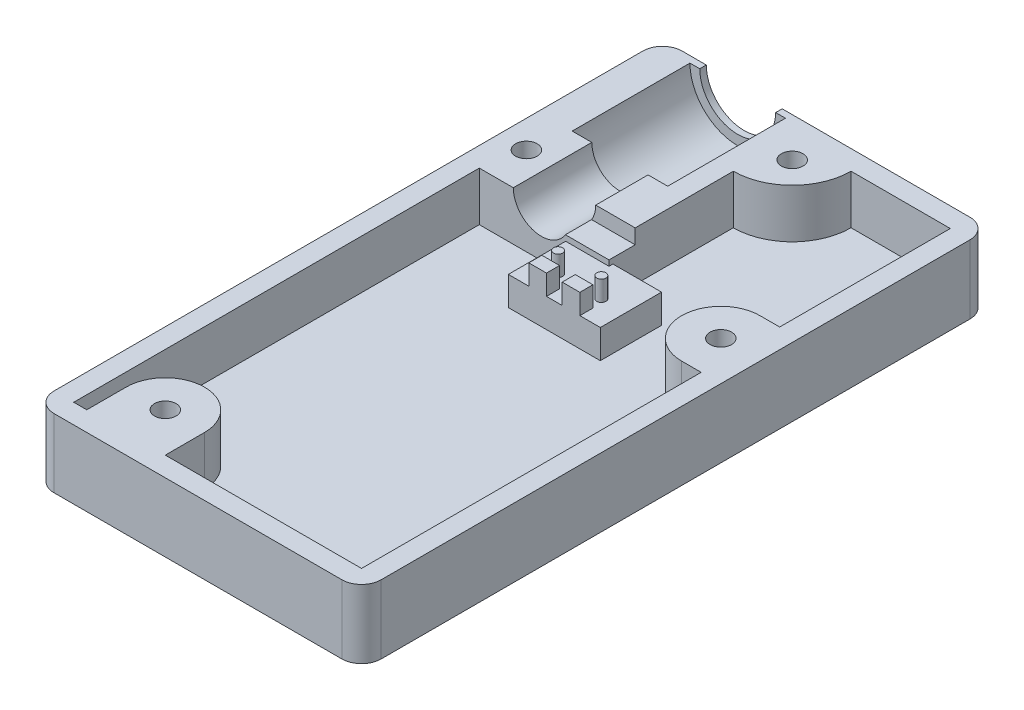
from build123d import *
from build123d.topology import SkipClean

# Parameters (mm, degrees)
SKETCH_1_W               = 50
SKETCH_1_H               = 38
EXTRUDE_1_DEPTH          = 3
SKETCH_2_W               = 50
SKETCH_2_H               = 38
SKETCH_2_W_2             = 44
SKETCH_2_H_2             = 32
EXTRUDE_2_DEPTH          = 90
SKETCH_4_R               = 7.3
CUT_EXTRUDE_1_DEPTH      = 45.2
SKETCH_5_R               = 10.3
SKETCH_5_R_2             = 7.3
EXTRUDE_3_DEPTH          = 16
SKETCH_6_R               = 8.3
SKETCH_6_R_2             = 5.8
EXTRUDE_5_DEPTH          = 1
SKETCH_7_R               = 4.3
EXTRUDE_6_DEPTH          = 2
SKETCH_8_R               = 6.3
SKETCH_8_R_2             = 4.3
EXTRUDE_7_DEPTH          = 10
SKETCH_9_W               = 2.635644668
SKETCH_9_H               = 4.5
CUT_EXTRUDE_2_DEPTH      = 4
SKETCH_10_R              = 0.7
SKETCH_10_W              = 2.7
SKETCH_10_H              = 2
EXTRUDE_8_DEPTH          = 32
SKETCH_11_W              = 14.06
SKETCH_11_H              = 9.36
EXTRUDE_9_DEPTH          = 4.4
SKETCH_12_W              = 14.06
SKETCH_12_H              = 9.36
EXTRUDE_10_DEPTH         = 21.2
CUT_EXTRUDE_3_DEPTH      = 3
SKETCH_14_R              = 1.65
EXTRUDE_11_DEPTH         = 15.5
EXTRUDE_12_DEPTH         = 15.5
CUT_EXTRUDE_4_DEPTH      = 0.8
EXTRUDE_13_DEPTH         = 18
SKETCH_18_W              = 19.83
SKETCH_18_H              = 32
SKETCH_18_R              = 6.3
EXTRUDE_14_DEPTH         = 10
SKETCH_19_W              = 4.445486426
SKETCH_19_H              = 4.5
CUT_EXTRUDE_5_DEPTH      = 4
EXTRUDE_16_REACH         = 110.743
SKETCH_23_R              = 1.65
CUT_EXTRUDE_7_DEPTH      = 109.742815855
CUT_EXTRUDE_7_DEPTH_BACK = 109.742815855
SKETCH_25_R              = 1.65
CUT_EXTRUDE_8_DEPTH      = 24.5
SKETCH_29_W              = 50
SKETCH_29_H              = 38
EXTRUDE_17_DEPTH         = 3
FILLET_1_R               = 3
SKETCH_30_W              = 96
SKETCH_30_H              = 0.02
CUT_EXTRUDE_9_DEPTH      = 113.218536793
SKETCH_31_R              = 3
CUT_EXTRUDE_10_DEPTH     = 2


with BuildPart() as part:
    # 草图1 → 凸台-拉伸1 (new body)
    with BuildSketch(Plane.XY):
        with Locations((25, 19)):
            Rectangle(SKETCH_1_W, SKETCH_1_H)
    extrude(amount=-EXTRUDE_1_DEPTH)

    # 草图2 → 凸台-拉伸2 (add)
    with BuildSketch(Plane.XY):
        with Locations((25, 19)):
            Rectangle(SKETCH_2_W, SKETCH_2_H)
        with Locations((25, 19)):
            Rectangle(SKETCH_2_W_2, SKETCH_2_H_2, mode=Mode.SUBTRACT)
    extrude(amount=EXTRUDE_2_DEPTH)

    # 草图4 → 切除-拉伸1 (cut)
    with BuildSketch(Plane(origin=(0, 0, -3), x_dir=(-1, 0, 0), z_dir=(0, 0, -1))):
        with Locations((-12.5, 10.5)):
            Circle(SKETCH_4_R)
    extrude(amount=-CUT_EXTRUDE_1_DEPTH, mode=Mode.SUBTRACT)

    # 草图5 → 凸台-拉伸3 (add)
    with BuildSketch(Plane.XY):
        with Locations((12.5, 10.5)):
            Circle(SKETCH_5_R)
        with Locations(Location((12.5, 10.5, 0), (0, 0, 180))):
            Circle(SKETCH_5_R_2, mode=Mode.SUBTRACT)
    extrude(amount=EXTRUDE_3_DEPTH)

    # 草图6 → 凸台-拉伸5 (add)
    with BuildSketch(Plane(origin=(0, 0, -3), x_dir=(-1, 0, 0), z_dir=(0, 0, -1))):
        with Locations((-12.5, 10.5)):
            Circle(SKETCH_6_R)
        with Locations((-12.5, 10.5)):
            Circle(SKETCH_6_R_2, mode=Mode.SUBTRACT)
    extrude(amount=-EXTRUDE_5_DEPTH)

    # 草图7 → 凸台-拉伸6 (add)
    with BuildSketch(Plane.XY.offset(16)):
        with BuildLine():
            Line((5.440254962, 3), (19.559745038, 3))
            ThreePointArc((19.559745038, 3), (18.368221419, 18.964867239), (3, 14.479949748))
            Line((3, 14.479949748), (3, 6.520050252))
            ThreePointArc((3, 6.520050252), (4.035132761, 4.631778581), (5.440254962, 3))
        make_face()
        with Locations((12.5, 10.5)):
            Circle(SKETCH_7_R, mode=Mode.SUBTRACT)
    extrude(amount=EXTRUDE_6_DEPTH)

    # 草图8 → 凸台-拉伸7 (add)
    with BuildSketch(Plane.XY.offset(18)):
        with Locations((12.5, 10.5)):
            Circle(SKETCH_8_R)
        with Locations((12.5, 10.5)):
            Circle(SKETCH_8_R_2, mode=Mode.SUBTRACT)
    extrude(amount=EXTRUDE_7_DEPTH)

    # 草图9 → 切除-拉伸2 (cut)
    with BuildSketch(Plane.XY.offset(28)):
        with Locations((17.482177666, 10.5)):
            Rectangle(SKETCH_9_W, SKETCH_9_H)
    extrude(amount=-CUT_EXTRUDE_2_DEPTH, mode=Mode.SUBTRACT)

    # 草图10 → 凸台-拉伸8 (add)
    with BuildSketch(Plane(origin=(0, 3, 0), x_dir=(1, 0, 0), z_dir=(0, 1, 0))):
        with Locations(Location((19.92, -32.88, 0), (0, 0, 180))):
            Circle(SKETCH_10_R)
        with Locations(Location((26.54, -32.88, 0), (0, 0, 180))):
            Circle(SKETCH_10_R)
        with Locations((20.68, -35.76)):
            Rectangle(SKETCH_10_W, SKETCH_10_H)
        with Locations((25.78, -35.76)):
            Rectangle(SKETCH_10_W, SKETCH_10_H)
    extrude(amount=EXTRUDE_8_DEPTH)

    # 草图11 → 凸台-拉伸9 (add)
    with BuildSketch(Plane(origin=(0, 3, 0), x_dir=(1, 0, 0), z_dir=(0, 1, 0))):
        with Locations((23.23, -32.08)):
            Rectangle(SKETCH_11_W, SKETCH_11_H)
    extrude(amount=EXTRUDE_9_DEPTH)

    # 草图12 → 凸台-拉伸10 (add)
    with BuildSketch(Plane.XZ.offset(-35)):
        with Locations((23.23, 32.08)):
            Rectangle(SKETCH_12_W, SKETCH_12_H)
    extrude(amount=EXTRUDE_10_DEPTH)

    # 草图13 → 切除-拉伸3 (cut)
    with BuildSketch(Plane(origin=(0, 38, 0), x_dir=(1, 0, 0), z_dir=(0, 1, 0))):
        with BuildLine():
            Line((38.62497216, -74.195968058), (44.4, -74.195968058))
            ThreePointArc((44.4, -74.195968058), (45.107106781, -73.903074839), (45.4, -73.195968058))
            Line((45.4, -73.195968058), (45.4, -54.995968058))
            ThreePointArc((45.4, -54.995968058), (45.107106781, -54.288861277), (44.4, -53.995968058))
            Line((44.4, -53.995968058), (38.62497216, -53.995968058))
            ThreePointArc((38.62497216, -53.995968058), (12.3, -64.095968058), (38.62497216, -74.195968058))
        make_face()
    extrude(amount=-CUT_EXTRUDE_3_DEPTH, mode=Mode.SUBTRACT)

    # 草图14 → 凸台-拉伸11 (add)
    # profile 1 of 2: a face of its own
    with SkipClean():  # the faces are left unmerged after this step: merging them gives an invalid solid
        with BuildSketch(Plane.XZ.offset(-35)):
            with BuildLine():
                Line((23.9, 46.595968058), (23.9, 49.407196837))
                ThreePointArc((23.9, 49.407196837), (27.4, 48.995968058), (30.9, 49.407196837))
                Line((30.9, 49.407196837), (30.9, 46.595968058))
                ThreePointArc((30.9, 46.595968058), (27.4, 43.095968058), (23.9, 46.595968058))
            make_face()
            with Locations((27.4, 46.595968058)):
                Circle(SKETCH_14_R, mode=Mode.SUBTRACT)
        # profile 2 of 2: a face of its own
        with BuildSketch(Plane.XZ.offset(-35)):
            with BuildLine():
                Line((30.9, 81.595968058), (30.9, 78.78473928))
                ThreePointArc((30.9, 78.78473928), (27.4, 79.195968058), (23.9, 78.78473928))
                Line((23.9, 78.78473928), (23.9, 81.595968058))
                ThreePointArc((23.9, 81.595968058), (27.4, 85.095968058), (30.9, 81.595968058))
            make_face()
            with Locations(Location((27.4, 81.595968058, 0), (0, 0, 90))):
                Circle(SKETCH_14_R, mode=Mode.SUBTRACT)
        extrude(amount=EXTRUDE_11_DEPTH)

    # 草图15 → 凸台-拉伸12 (add)
    with SkipClean():  # the faces are left unmerged after this step: merging them gives an invalid solid
        with BuildSketch(Plane.XZ.offset(-35)):
            with BuildLine():
                ThreePointArc((23.9, 49.407196837), (22.109340992, 49.953163271), (20.4, 50.716506186))
                Line((20.4, 50.716506186), (20.4, 46.595968058))
                ThreePointArc((20.4, 46.595968058), (27.4, 39.595968058), (34.4, 46.595968058))
                Line((34.4, 46.595968058), (34.4, 50.716506186))
                ThreePointArc((34.4, 50.716506186), (32.690659008, 49.953163271), (30.9, 49.407196837))
                Line((30.9, 49.407196837), (30.9, 46.595968058))
                ThreePointArc((30.9, 46.595968058), (27.4, 43.095968058), (23.9, 46.595968058))
                Line((23.9, 46.595968058), (23.9, 49.407196837))
            make_face()
            with BuildLine():
                Line((20.4, 81.595968058), (20.4, 77.475429931))
                ThreePointArc((20.4, 77.475429931), (22.109340992, 78.238772846), (23.9, 78.78473928))
                Line((23.9, 78.78473928), (23.9, 81.595968058))
                ThreePointArc((23.9, 81.595968058), (27.4, 85.095968058), (30.9, 81.595968058))
                Line((30.9, 81.595968058), (30.9, 78.78473928))
                ThreePointArc((30.9, 78.78473928), (32.690659008, 78.238772846), (34.4, 77.475429931))
                Line((34.4, 77.475429931), (34.4, 81.595968058))
                ThreePointArc((34.4, 81.595968058), (27.4, 88.595968058), (20.4, 81.595968058))
            make_face()
        extrude(amount=EXTRUDE_12_DEPTH)

    # 草图16 → 切除-拉伸4 (cut)
    with SkipClean():  # the faces are left unmerged after this step: merging them gives an invalid solid
        with BuildSketch(Plane.XZ.offset(-19.5)):
            with BuildLine():
                Line((31.3, 81.595968058), (31.3, 77.229132186))
                ThreePointArc((31.3, 77.229132186), (27.4, 77.795968058), (23.5, 77.229132186))
                Line((23.5, 77.229132186), (23.5, 81.595968058))
                ThreePointArc((23.5, 81.595968058), (27.4, 85.495968058), (31.3, 81.595968058))
            make_face()
            with BuildLine():
                Line((31.3, 46.595968058), (31.3, 50.962803931))
                ThreePointArc((31.3, 50.962803931), (27.4, 50.395968058), (23.5, 50.962803931))
                Line((23.5, 50.962803931), (23.5, 46.595968058))
                ThreePointArc((23.5, 46.595968058), (27.4, 42.695968058), (31.3, 46.595968058))
            make_face()
        extrude(amount=-CUT_EXTRUDE_4_DEPTH, mode=Mode.SUBTRACT)

    # 草图17 → 凸台-拉伸13 (add)
    with SkipClean():  # the faces are left unmerged after this step: merging them gives an invalid solid
        with BuildSketch(Plane.XY):
            with BuildLine():
                Line((22.83, 3), (22.83, 10.539153682))
                Line((22.83, 10.539153682), (22.83, 35))
                Line((22.83, 35), (3, 35))
                Line((3, 35), (3, 14.479949748))
                ThreePointArc((3, 14.479949748), (18.368221419, 18.964867239), (19.559745038, 3))
                Line((19.559745038, 3), (22.83, 3))
            make_face()
            with BuildLine():
                Line((5.440254962, 3), (3, 3))
                Line((3, 3), (3, 6.520050252))
                ThreePointArc((3, 6.520050252), (4.035132761, 4.631778581), (5.440254962, 3))
            make_face()
        extrude(amount=EXTRUDE_13_DEPTH)

    # 草图18 → 凸台-拉伸14 (add)
    with SkipClean():  # the faces are left unmerged after this step: merging them gives an invalid solid
        with BuildSketch(Plane.XY.offset(18)):
            with Locations((12.915, 19)):
                Rectangle(SKETCH_18_W, SKETCH_18_H)
            with Locations((12.5, 10.5)):
                Circle(SKETCH_18_R, mode=Mode.SUBTRACT)
        extrude(amount=EXTRUDE_14_DEPTH)

    # 草图19 → 切除-拉伸5 (cut)
    with SkipClean():  # the faces are left unmerged after this step: merging them gives an invalid solid
        with BuildSketch(Plane.XY.offset(28)):
            with Locations((20.607256787, 10.5)):
                Rectangle(SKETCH_19_W, SKETCH_19_H)
        extrude(amount=-CUT_EXTRUDE_5_DEPTH, mode=Mode.SUBTRACT)

    # 草图23 → 凸台-拉伸16 (add, up to next)
    with BuildSketch(Plane.XZ.offset(-35), mode=Mode.PRIVATE) as extrude_16_sk1:
        with BuildLine():
            Line((22.83, 0), (22.83, 9))
            ThreePointArc((22.83, 9), (29.193961031, 6.363961031), (31.83, 0))
            Line((31.83, 0), (22.83, 0))
        make_face()
        with Locations(Location((25.83, 3, 0), (0, 0, 180))):
            Circle(SKETCH_23_R, mode=Mode.SUBTRACT)
    extrude_16_tool1 = extrude(extrude_16_sk1.sketch, amount=EXTRUDE_16_REACH, mode=Mode.PRIVATE) - part.part
    # 草图23 → 凸台-拉伸16 (add, up to next)
    with BuildSketch(Plane.XZ.offset(-35), mode=Mode.PRIVATE) as extrude_16_sk2:
        with BuildLine():
            Line((44, 26.08), (47, 26.08))
            Line((47, 26.08), (47, 38.08))
            Line((47, 38.08), (44, 38.08))
            ThreePointArc((44, 38.08), (38, 32.08), (44, 26.08))
        make_face()
        with Locations(Location((44, 32.08, 0), (0, 0, 180))):
            Circle(SKETCH_23_R, mode=Mode.SUBTRACT)
    extrude_16_tool2 = extrude(extrude_16_sk2.sketch, amount=EXTRUDE_16_REACH, mode=Mode.PRIVATE) - part.part
    # 草图23 → 凸台-拉伸16 (add, up to next)
    with BuildSketch(Plane.XZ.offset(-35), mode=Mode.PRIVATE) as extrude_16_sk3:
        with BuildLine():
            Line((5, 90), (5, 84))
            ThreePointArc((5, 84), (11, 78), (17, 84))
            Line((17, 84), (17, 90))
            Line((17, 90), (5, 90))
        make_face()
        with Locations(Location((11, 84, 0), (0, 0, 180))):
            Circle(SKETCH_23_R, mode=Mode.SUBTRACT)
    extrude_16_tool3 = extrude(extrude_16_sk3.sketch, amount=EXTRUDE_16_REACH, mode=Mode.PRIVATE) - part.part
    add(extrude_16_tool1.solids().sort_by_distance((27.33, 35, 0.127279))[0])
    add(extrude_16_tool2.solids().sort_by_distance((45.5, 35, 26.23))[0])
    add(extrude_16_tool3.solids().sort_by_distance((11, 35, 78.169706))[0])

    # 草图25 → 切除-拉伸7 (cut, two sides: drawn at the far end of the back side and taken through both)
    with BuildSketch(Plane.XZ.offset(-35).offset(-CUT_EXTRUDE_7_DEPTH_BACK)):
        with Locations((4.2, 22)):
            Circle(SKETCH_25_R)
        with Locations((25.83, 3)):
            Circle(SKETCH_25_R)
        with Locations((44, 32.08)):
            Circle(SKETCH_25_R)
        with Locations((11, 84)):
            Circle(SKETCH_25_R)
    extrude(amount=CUT_EXTRUDE_7_DEPTH + CUT_EXTRUDE_7_DEPTH_BACK, mode=Mode.SUBTRACT)

    # 草图26 → 切除-拉伸8 (cut)
    with SkipClean():  # the faces are left unmerged after this step: merging them gives an invalid solid
        with BuildSketch(Plane(origin=(0, 38, 0), x_dir=(1, 0, 0), z_dir=(0, 1, 0))):
            Polygon((4.2, -18.537081721), (1.201024799, -20.268540861), (1.201024799, -23.731459139), (4.2, -25.462918279), (7.198975201, -23.731459139), (7.198975201, -20.268540861), align=None)
            Polygon((25.83, -6.462918279), (28.828975201, -4.731459139), (28.828975201, -1.268540861), (25.83, 0.462918279), (22.831024799, -1.268540861), (22.831024799, -4.731459139), align=None)
            Polygon((11, -80.537081721), (8.001024799, -82.268540861), (8.001024799, -85.731459139), (11, -87.462918279), (13.998975201, -85.731459139), (13.998975201, -82.268540861), align=None)
            Polygon((44, -28.617081721), (41.001024799, -30.348540861), (41.001024799, -33.811459139), (44, -35.542918279), (46.998975201, -33.811459139), (46.998975201, -30.348540861), align=None)
        extrude(amount=-CUT_EXTRUDE_8_DEPTH, mode=Mode.SUBTRACT)

    # 草图29 → 凸台-拉伸17 (add)
    with SkipClean():  # the faces are left unmerged after this step: merging them gives an invalid solid
        with BuildSketch(Plane.XY.offset(90)):
            with Locations((25, 19)):
                Rectangle(SKETCH_29_W, SKETCH_29_H)
        extrude(amount=EXTRUDE_17_DEPTH)

    # 圆角1
    fillet_1_edges = [part.edges().sort_by_distance(p)[0] for p in [
        (0, 19, -3),
        (50, 19, -3),
        (0, 19, 93),
        (50, 19, 93),
    ]]
    fillet(fillet_1_edges, radius=FILLET_1_R - 0.0001)  # a hair under: the kernel refuses the full size

    # 草图30 → 切除-拉伸9 (cut, through all)
    with BuildSketch(Plane(origin=(50, 0, 0), x_dir=(0, 0, -1), z_dir=(1, 0, 0))):
        with Locations((-45, 10.5)):
            Rectangle(SKETCH_30_W, SKETCH_30_H)
    extrude(amount=-CUT_EXTRUDE_9_DEPTH, mode=Mode.SUBTRACT)


with BuildPart() as cut_extrude_9_piece_1:
    # of the separate pieces the step leaves, piece 1, a body of its own (cut_extrude_9_pieces)
    add(part.part.solids().sort_by_distance((47.0001, 38, -3))[0])


with BuildPart() as cut_extrude_9_piece_2:
    # of the separate pieces the step leaves, piece 2, a body of its own (cut_extrude_9_pieces)
    add(part.part.solids().sort_by_distance((47.0001, 0, -3))[0])

    # 草图31 → 切除-拉伸10 (cut)
    with BuildSketch(Plane.XZ):
        with Locations((4.2, 22)):
            Circle(SKETCH_31_R)
        with Locations((25.83, 3)):
            Circle(SKETCH_31_R)
        with Locations((11, 84)):
            Circle(SKETCH_31_R)
        with Locations((44, 32.08)):
            Circle(SKETCH_31_R)
    extrude(amount=-CUT_EXTRUDE_10_DEPTH, mode=Mode.SUBTRACT)


solid = cut_extrude_9_piece_2.part
